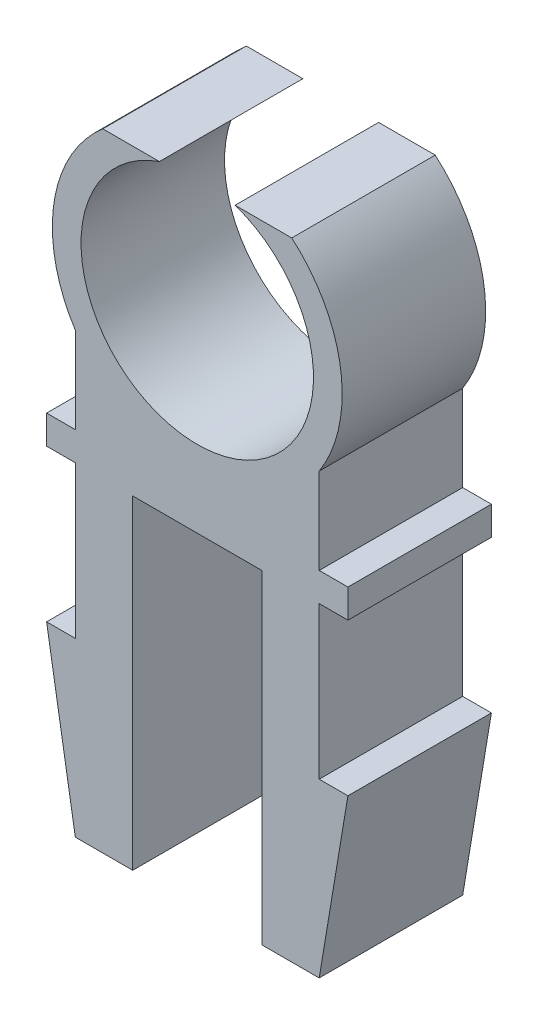
from build123d import *

# Parameters (mm, degrees)
SKETCH2_W           = 1
SKETCH2_H           = 1.0000000000000009
BOSS_EXTRUDE1_DEPTH = 2.5
SNAP_START          = -2.5
SNAP_HOOK2_DEPTH    = 5


# Read off the part's stored shape, not the designer's step: Snap Hook2
with BuildPart() as part:
    # Sketch2 → Boss-Extrude1 (new, symmetric)
    with BuildSketch(Plane.XY):
        with BuildLine():
            Line((-1.319469931058069, 3.8290337033034687), (-3.2925675238278904, 3.8290337033034683))
            ThreePointArc((-3.2925675238278913, 3.829033703303468), (-4.9970052756714, 0.7296836814073608), (-4.25, -2.727636339397171))
            Line((-4.249999999999999, -2.7276363393971716), (-2.9937434759844463, -2.7276363393971716))
            ThreePointArc((-2.9937434759844717, -2.7276363393972467), (-3.9240837129048374, 1.0020314436757887), (-1.319469931058064, 3.829033703303436))
        make_face()
        with BuildLine():
            ThreePointArc((5.05, 0), (4.589660444702355, 2.1065414789019883), (3.29256752382789, 3.8290337033034683))
            Line((3.2925675238278904, 3.829033703303469), (1.3194699310580464, 3.8290337033034687))
            ThreePointArc((1.3194699310580424, 3.8290337033034434), (3.2974500163599956, 2.351451336857189), (4.05, 0))
            ThreePointArc((4.05, -9.9e-16), (3.7767155755853006, -1.4625045166191415), (2.9937434759845, -2.7276363393972156))
            Line((2.993743475984485, -2.7276363393971708), (4.250000000000001, -2.7276363393971708))
            ThreePointArc((4.25, -2.7276363393971708), (4.84587453407535, -1.421267040355192), (5.05, -1.24e-15))
        make_face()
        with BuildLine():
            Line((-2.9937434759844463, -2.7276363393971716), (-4.249999999999999, -2.7276363393971716))
            ThreePointArc((-4.25, -2.727636339397171), (-2.421563181711757, -4.431538305935991), (7.981e-14, -5.05))
            Line((1.49e-15, -5.05), (1.34e-15, -4.05))
            ThreePointArc((-5.11e-14, -4.05), (-1.636394332891877, -3.7046880553265678), (-2.9937434759844717, -2.7276363393972467))
        make_face()
        with BuildLine():
            Line((1.34e-15, -4.05), (1.49e-15, -5.05))
            ThreePointArc((7.981e-14, -5.05), (2.4215631817118264, -4.431538305935953), (4.25, -2.7276363393971708))
            Line((4.250000000000001, -2.7276363393971708), (2.993743475984485, -2.7276363393971708))
            ThreePointArc((2.9937434759845, -2.7276363393972156), (1.6363943328918495, -3.7046880553265797), (-5.11e-14, -4.05))
        make_face()
        with BuildLine():
            ThreePointArc((7.981e-14, -5.05), (-2.421563181711757, -4.431538305935991), (-4.25, -2.727636339397171))
            Line((-4.249999999999999, -2.7276363393971716), (-4.249999999999998, -5.727636339397171))
            Line((-4.249999999999998, -5.727636339397171), (-4.249999999999998, -6.727636339397172))
            Line((-4.249999999999998, -6.727636339397172), (1.78e-15, -6.727636339397172))
            Line((1.73e-15, -6.727636339397171), (1.49e-15, -5.05))
        make_face()
        with Locations((-4.749999999999998, -6.227636339397172)):
            Rectangle(SKETCH2_W, SKETCH2_H)
        with BuildLine():
            ThreePointArc((4.25, -2.7276363393971708), (2.4215631817118264, -4.431538305935953), (7.981e-14, -5.05))
            Line((1.49e-15, -5.05), (1.73e-15, -6.727636339397171))
            Line((1.78e-15, -6.727636339397172), (4.250000000000002, -6.727636339397171))
            Line((4.250000000000002, -6.72763633939717), (4.250000000000002, -5.72763633939717))
            Line((4.250000000000002, -5.72763633939717), (4.250000000000001, -2.7276363393971708))
        make_face()
        Polygon((4.250000000000002, -5.72763633939717), (4.250000000000002, -6.72763633939717), (5.250000000000002, -6.727636339397171), (5.250000000000002, -5.72763633939717), align=None)
    extrude(amount=BOSS_EXTRUDE1_DEPTH, both=True)

    # Snap Hook2 outline → Snap Hook2 (add)
    with BuildSketch(Plane.XY.offset(SNAP_START)):
        Polygon((5.25, -12.027636339), (4.25, -12.027636339), (4.25, -6.727636339), (2.25, -6.727636339), (2.25, -18.027636339), (4.25, -18.027636339), align=None)
    snap_hook2 = extrude(amount=SNAP_HOOK2_DEPTH)

    # Mirror1: Snap Hook2 across plane
    add(snap_hook2.mirror(Plane(origin=(0, 0, 0), x_dir=(0, 0, 1), z_dir=(1, 0, 0))))


solid = part.part
